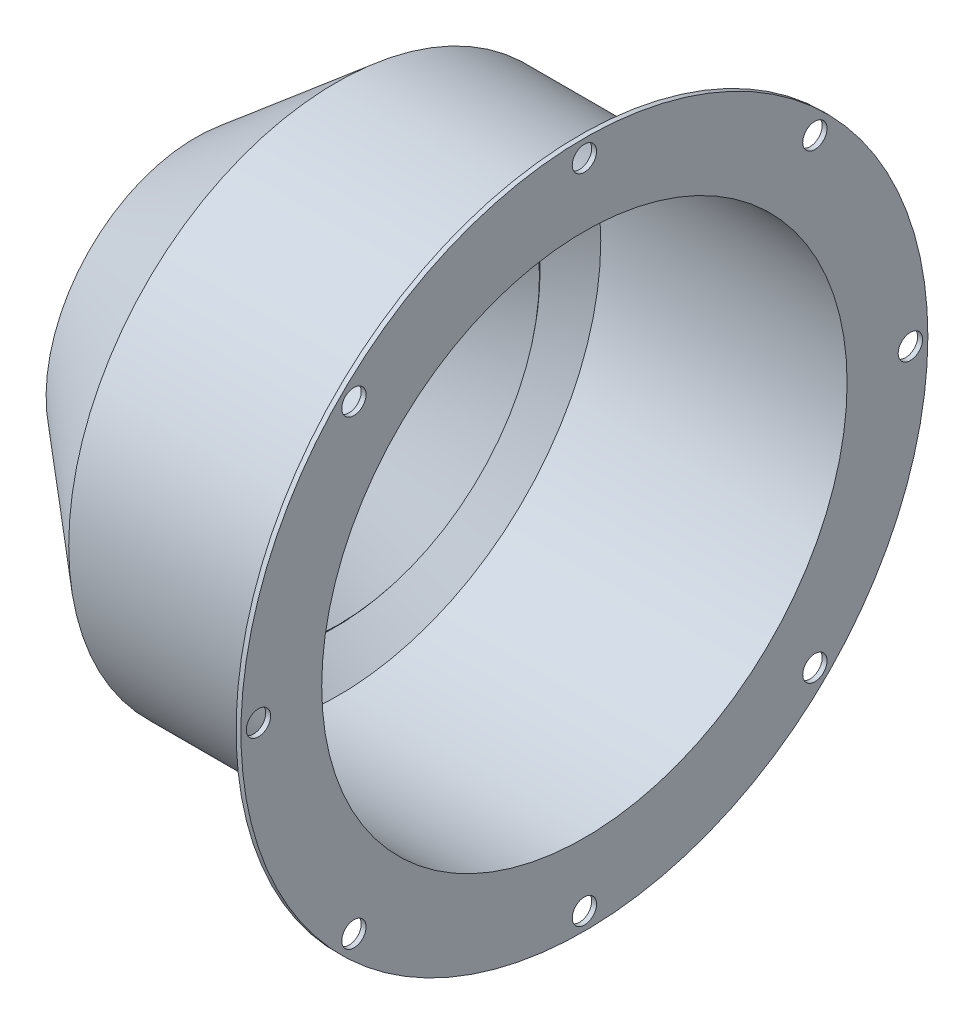
from build123d import *

# Parameters (mm, degrees)
SKETCH5_R           = 3.175
CUT_EXTRUDE1_DEPTH  = 2.54
BOSS_EXTRUDE1_DEPTH = 0.635
CIRPATTERN1_COUNT   = 4


with BuildPart() as part:
    # Sketch2 → Revolve1 (revolve)
    with BuildSketch(Plane(origin=(-67.327605866, 12.964436359, 6.379826334), x_dir=(1, 0, 0), z_dir=(0, 0, -1))):
        Polygon((19.05, 89.662), (19.05, 68.58), (-45.257757802, 68.58), (-81.582407305, 38.1), (-82.398747569, 39.072876443), (-45.72, 69.85), (17.78, 69.85), (17.78, 89.662), align=None)
    revolve(axis=Axis((-25.997171046, 12.964436359, 6.379826334), (-1, 0, 0)))

    # Sketch5 → Cut-Extrude1 (cut)
    with BuildSketch(Plane.ZY.offset(49.547605866)):
        with Locations((6.379826334, 98.054436359)):
            Circle(SKETCH5_R)
        with Locations((66.547542345, 73.13215237)):
            Circle(SKETCH5_R)
        with Locations((91.469826334, 12.964436359)):
            Circle(SKETCH5_R)
        with Locations((66.547542345, -47.203279652)):
            Circle(SKETCH5_R)
        with Locations((6.379826334, -72.125563641)):
            Circle(SKETCH5_R)
        with Locations((-53.787889677, -47.203279652)):
            Circle(SKETCH5_R)
        with Locations((-78.710173666, 12.964436359)):
            Circle(SKETCH5_R)
        with Locations((-53.787889677, 73.13215237)):
            Circle(SKETCH5_R)
    extrude(amount=-CUT_EXTRUDE1_DEPTH, mode=Mode.SUBTRACT)



with BuildPart() as body_2:
    # Sketch4 → Revolve4 (revolve)
    with BuildSketch(Plane(origin=(88.374394134, 12.964436359, 6.379826334), x_dir=(1, 0, 0), z_dir=(0, 0, 1))):
        Polygon((-200.959757802, 52.578), (-263.265893439, 0.296944568), (-264.082233703, 1.26982101), (-201.776098067, 53.550876443), align=None)
    revolve(axis=Axis((-77.838260496, 12.964436359, 6.379826334), (-1, 0, 0)))


with BuildPart() as part_1:
    add(part.part)

    add(body_2.part)  # Boss-Extrude1 merges body 2
    # Sketch6 → Boss-Extrude1 (add, symmetric)
    with BuildSketch(Plane(origin=(88.374394134, 12.964436359, 6.379826334), x_dir=(1, 0, 0), z_dir=(0, 0, 1))):
        Polygon((-240.929921058, 35.219583178), (-233.080773337, 25.865333182), (-223.352008909, 34.028735825), (-231.20115663, 43.382985821), align=None)
    boss_extrude1 = extrude(amount=BOSS_EXTRUDE1_DEPTH, both=True)

    # CirPattern1: Boss-Extrude1 ×4 about axis
    cirpattern1_axis = Axis((-113.047605866, 12.964436359, 6.379826334), (-1, 0, 0))
    for i in range(1, CIRPATTERN1_COUNT):
        add(boss_extrude1.rotate(cirpattern1_axis, i * 360 / CIRPATTERN1_COUNT))


solid = part_1.part
